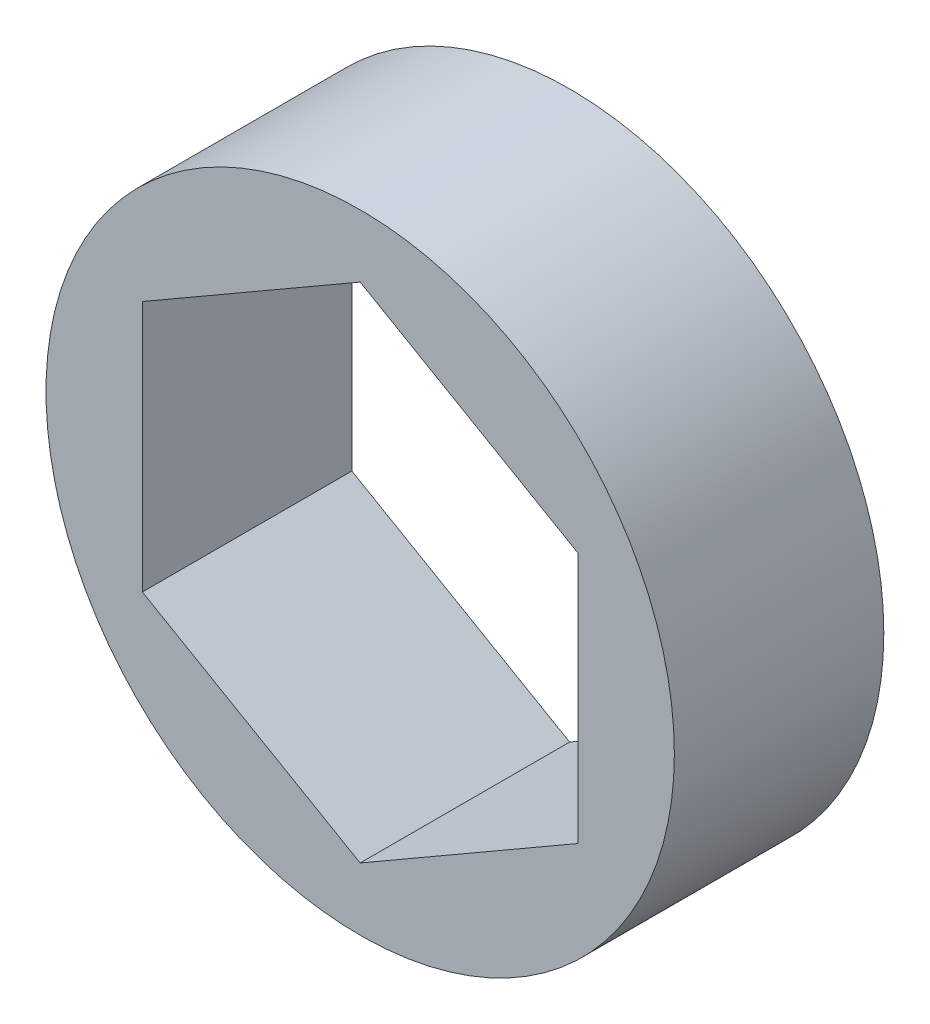
from build123d import *

# Parameters (mm, degrees)
SKETCH1_R           = 9.525
BOSS_EXTRUDE1_DEPTH = 3.175


with BuildPart() as part:
    # Sketch1 → Boss-Extrude1 (new, symmetric)
    with BuildSketch(Plane.XY):
        Circle(SKETCH1_R)
        Polygon((0, 7.625642355), (-6.604, 3.812821178), (-6.604, -3.812821178), (0, -7.625642355), (6.604, -3.812821178), (6.604, 3.812821178), align=None, mode=Mode.SUBTRACT)
    extrude(amount=BOSS_EXTRUDE1_DEPTH, both=True)


solid = part.part
